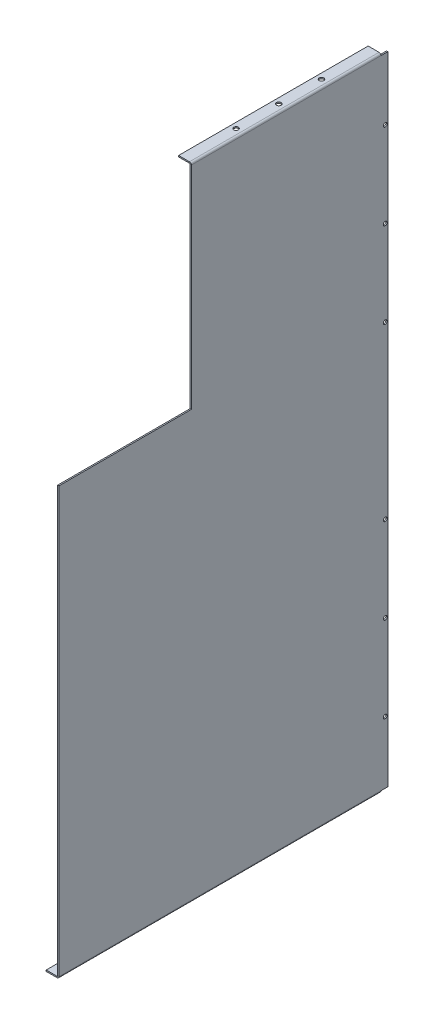
from build123d import *

# Parameters (mm, degrees)
SKETCH_1_W                       = 1.5
SKETCH_1_H                       = 750
SM_BASE_FLANGE_1_DEPTH           = 385
SM_EDGE_FLANGE_1_STRIP_W         = 7.4732
SM_EDGE_FLANGE_1_STRIP_H         = 1.5
SM_EDGE_FLANGE_1_STRIP_CUT_DEPTH = 385
SM_EDGE_FLANGE_1_DEPTH           = 385
SM_EDGE_FLANGE_2_STRIP_W         = 7.4732
SM_EDGE_FLANGE_2_STRIP_H         = 1.5
SM_EDGE_FLANGE_2_STRIP_CUT_DEPTH = 385
SM_EDGE_FLANGE_2_DEPTH           = 385
SKETCH_12_W                      = 17.104155355
SKETCH_12_H                      = 8.497904819
CUT_EXTRUDE_1_DEPTH              = 8
CUT_EXTRUDE_START                = -8
CUT_EXTRUDE_3_DEPTH              = 8
SKETCH_16_W                      = 51.042433358
SKETCH_16_H                      = 155
CUT_EXTRUDE_4_DEPTH              = 248.5
SKETCH_17_R                      = 2.75
CUT_EXTRUDE_5_DEPTH              = 20
SKETCH_18_R                      = 2.75
CUT_EXTRUDE_6_DEPTH              = 20
SKETCH_19_W                      = 1.5
SKETCH_19_H                      = 155
CUT_EXTRUDE_7_DEPTH              = 1.5
SKETCH_21_R                      = 2.25
CUT_EXTRUDE_9_DEPTH              = 10


# Read off the part's stored shape, not the designer's step: 切除-拉伸3
# Sheet-metal steps are written as plain solids
with BuildPart() as part:
    # Sketch 1 → 基体-法兰1 (new body)
    with BuildSketch(Plane.XY):
        with Locations((0.75, 375)):
            Rectangle(SKETCH_1_W, SKETCH_1_H)
    extrude(amount=SM_BASE_FLANGE_1_DEPTH)

    # 边线-法兰1 strip (across the edge) → 边线-法兰1 strip cut (cut)
    with BuildSketch(Plane(origin=(0, 750, 385), x_dir=(0, -1, 0), z_dir=(0, 0, -1))):
        with Locations((-1.5, -0.75)):
            Rectangle(SM_EDGE_FLANGE_1_STRIP_W, SM_EDGE_FLANGE_1_STRIP_H)
    extrude(amount=SM_EDGE_FLANGE_1_STRIP_CUT_DEPTH, mode=Mode.SUBTRACT)

    # 边线-法兰1 section (across the edge) → 边线-法兰1 (add)
    with BuildSketch(Plane(origin=(0, 750, 385), x_dir=(0, -1, 0), z_dir=(0, 0, -1))):
        with BuildLine():
            Line((0, 0.7366), (0, 13.5))
            Line((0, 13.5), (1.5, 13.5))
            Line((1.5, 13.5), (1.5, 0.7366))
            ThreePointArc((1.5, 0.7366), (1.715745145, 0.215745145), (2.2366, 0))
            Line((2.2366, 0), (2.2366, -1.5))
            ThreePointArc((2.2366, -1.5), (0.655084973, -0.844915027), (0, 0.7366))
        make_face()
    extrude(amount=SM_EDGE_FLANGE_1_DEPTH)

    # 边线-法兰2 strip (across the edge) → 边线-法兰2 strip cut (cut)
    with BuildSketch(Plane(origin=(0, 0, 0), x_dir=(0, 1, 0), z_dir=(0, 0, 1))):
        with Locations((-1.5, -0.75)):
            Rectangle(SM_EDGE_FLANGE_2_STRIP_W, SM_EDGE_FLANGE_2_STRIP_H)
    extrude(amount=SM_EDGE_FLANGE_2_STRIP_CUT_DEPTH, mode=Mode.SUBTRACT)

    # 边线-法兰2 section (across the edge) → 边线-法兰2 (add)
    with BuildSketch(Plane(origin=(0, 0, 0), x_dir=(0, 1, 0), z_dir=(0, 0, 1))):
        with BuildLine():
            Line((0, 0.7366), (0, 13.5))
            Line((0, 13.5), (1.5, 13.5))
            Line((1.5, 13.5), (1.5, 0.7366))
            ThreePointArc((1.5, 0.7366), (1.715745145, 0.215745145), (2.2366, 0))
            Line((2.2366, 0), (2.2366, -1.5))
            ThreePointArc((2.2366, -1.5), (0.655084973, -0.844915027), (0, 0.7366))
        make_face()
    extrude(amount=SM_EDGE_FLANGE_2_DEPTH)

    # 草图12 → 切除-拉伸1 (cut)
    with BuildSketch(Plane(origin=(0, 0, 0), x_dir=(-1, 0, 0), z_dir=(0, 0, -1))):
        with Locations((7.052077678, 752.01235241)):
            Rectangle(SKETCH_12_W, SKETCH_12_H)
    extrude(amount=-CUT_EXTRUDE_1_DEPTH, mode=Mode.SUBTRACT)

    # 切除-拉伸3 outline → 切除-拉伸3 (cut)
    with BuildSketch(Plane(origin=(0, 0, 0), x_dir=(-1, 0, 0), z_dir=(0, 0, -1)).offset(CUT_EXTRUDE_START)):
        with BuildLine():
            Line((0, 2.2366), (-1.5, 2.2366))
            ThreePointArc((-1.5, 2.2366), (-0.844915027, 0.655084973), (0.7366, 0))
            Line((0.7366, 0), (13.5, 0))
            Line((13.5, 0), (13.5, 1.5))
            Line((13.5, 1.5), (0.7366, 1.5))
            ThreePointArc((0.7366, 1.5), (0.215745145, 1.715745145), (0, 2.2366))
        make_face()
    extrude(amount=CUT_EXTRUDE_3_DEPTH, mode=Mode.SUBTRACT)

    # 草图16 → 切除-拉伸4 (cut)
    with BuildSketch(Plane(origin=(0, 750, 0), x_dir=(1, 0, 0), z_dir=(0, 1, 0))):
        with Locations((12.021216679, -307.5)):
            Rectangle(SKETCH_16_W, SKETCH_16_H)
    extrude(amount=-CUT_EXTRUDE_4_DEPTH, mode=Mode.SUBTRACT)

    # 草图17 → 切除-拉伸5 (cut)
    with BuildSketch(Plane(origin=(0, 1.5, 0), x_dir=(1, 0, 0), z_dir=(0, 1, 0))):
        with Locations(Location((-7.1183, -296.5, 0), (0, 0, 180))):
            Circle(SKETCH_17_R)
        with Locations(Location((-7.1183, -196.5, 0), (0, 0, 180))):
            Circle(SKETCH_17_R)
        with Locations((-7.1183, -96.5)):
            Circle(SKETCH_17_R)
    extrude(amount=-CUT_EXTRUDE_5_DEPTH, mode=Mode.SUBTRACT)

    # 草图18 → 切除-拉伸6 (cut)
    with BuildSketch(Plane.XZ.offset(-748.5)):
        with Locations(Location((-7.1183, 69, 0), (0, 0, 270))):
            Circle(SKETCH_18_R)
        with Locations(Location((-7.1183, 119, 0), (0, 0, 270))):
            Circle(SKETCH_18_R)
        with Locations(Location((-7.1183, 169, 0), (0, 0, 270))):
            Circle(SKETCH_18_R)
    extrude(amount=-CUT_EXTRUDE_6_DEPTH, mode=Mode.SUBTRACT)

    # 草图19 → 切除-拉伸7 (cut)
    with BuildSketch(Plane(origin=(0, 501.5, 0), x_dir=(1, 0, 0), z_dir=(0, 1, 0))):
        with Locations((0.75, -307.5)):
            Rectangle(SKETCH_19_W, SKETCH_19_H)
    extrude(amount=-CUT_EXTRUDE_7_DEPTH, mode=Mode.SUBTRACT)

    # 草图21 → 切除-拉伸9 (cut)
    with BuildSketch(Plane(origin=(1.5, 0, 0), x_dir=(0, 0, -1), z_dir=(1, 0, 0))):
        with Locations((-3, 75)):
            Circle(SKETCH_21_R)
        with Locations((-3, 175)):
            Circle(SKETCH_21_R)
        with Locations((-3, 275)):
            Circle(SKETCH_21_R)
        with Locations(Location((-3, 475, 0), (0, 0, 180))):
            Circle(SKETCH_21_R)
        with Locations(Location((-3, 575, 0), (0, 0, 180))):
            Circle(SKETCH_21_R)
        with Locations(Location((-3, 675, 0), (0, 0, 180))):
            Circle(SKETCH_21_R)
    extrude(amount=-CUT_EXTRUDE_9_DEPTH, mode=Mode.SUBTRACT)


solid = part.part
